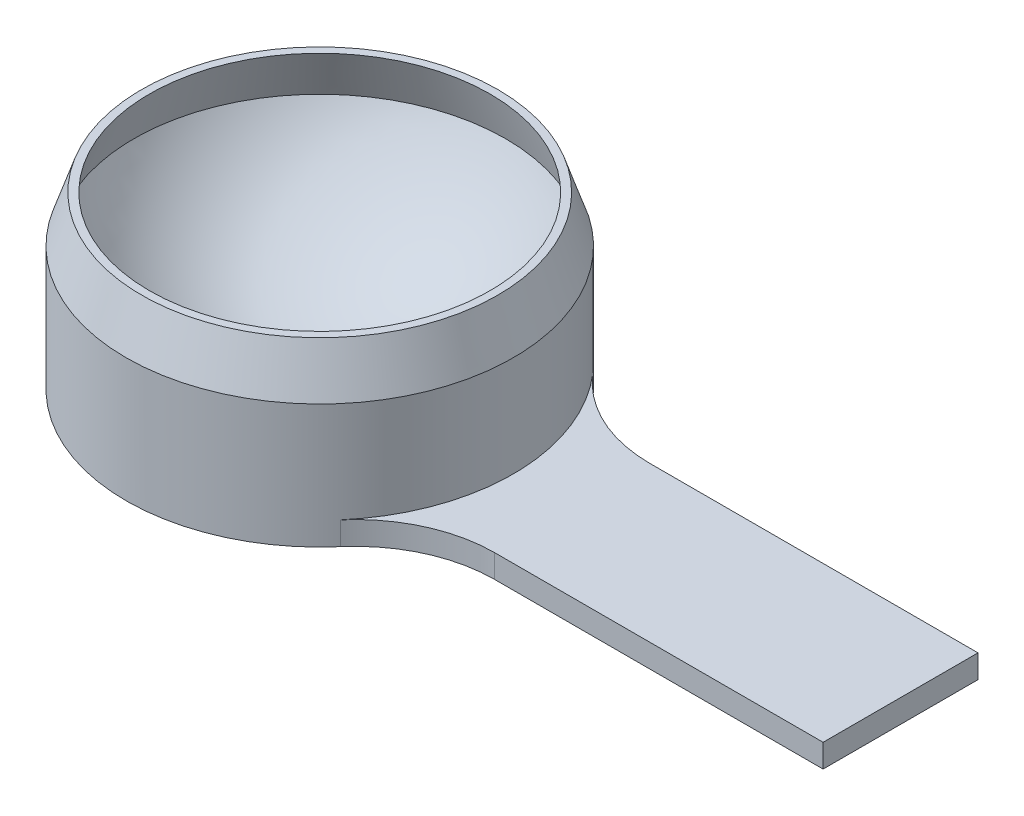
from build123d import *

# Parameters (mm, degrees)
BOSS_EXTRUDE2_START = 3
BOSS_EXTRUDE2_DEPTH = 3


with BuildPart() as part:
    # Sketch6 → Revolve1 (revolve)
    with BuildSketch(Plane(origin=(0, 0, 0), x_dir=(0, 0, -1), z_dir=(1, 0, 0))):
        with BuildLine():
            Line((0, 0), (-25, 0))
            Line((-25, 0), (-25, 16))
            Line((-25, 16), (-23, 22))
            Line((-23, 22), (-22, 22))
            Line((-22, 22), (-24, 16))
            ThreePointArc((-24, 16), (-14.150971698, 5.058445283), (0, 1))
            Line((0, 1), (0, 0))
        make_face()
    revolve(axis=Axis((0, 0.628504357, 0), (0, 1, 0)))

    # Sketch7 → Boss-Extrude2 (add)
    with BuildSketch(Plane(origin=(0, 0, 0), x_dir=(1, 0, 0), z_dir=(0, 1, 0)).offset(BOSS_EXTRUDE2_START)):
        with BuildLine():
            Line((32.550475895, 10.000254827), (75, 10.000254827))
            Line((75, 10.000254827), (75, -10.000254827))
            Line((75, -10.000254827), (32.550475895, -10.000254827))
            ThreePointArc((32.550475895, -10.000254827), (25.076770673, -11.666329849), (18.968914762, -16.284356689))
            ThreePointArc((18.968914762, -16.284356689), (25, 0), (18.968914762, 16.284356689))
            ThreePointArc((18.968914762, 16.284356689), (25.076770673, 11.666329849), (32.550475895, 10.000254827))
        make_face()
    extrude(amount=-BOSS_EXTRUDE2_DEPTH)


solid = part.part
